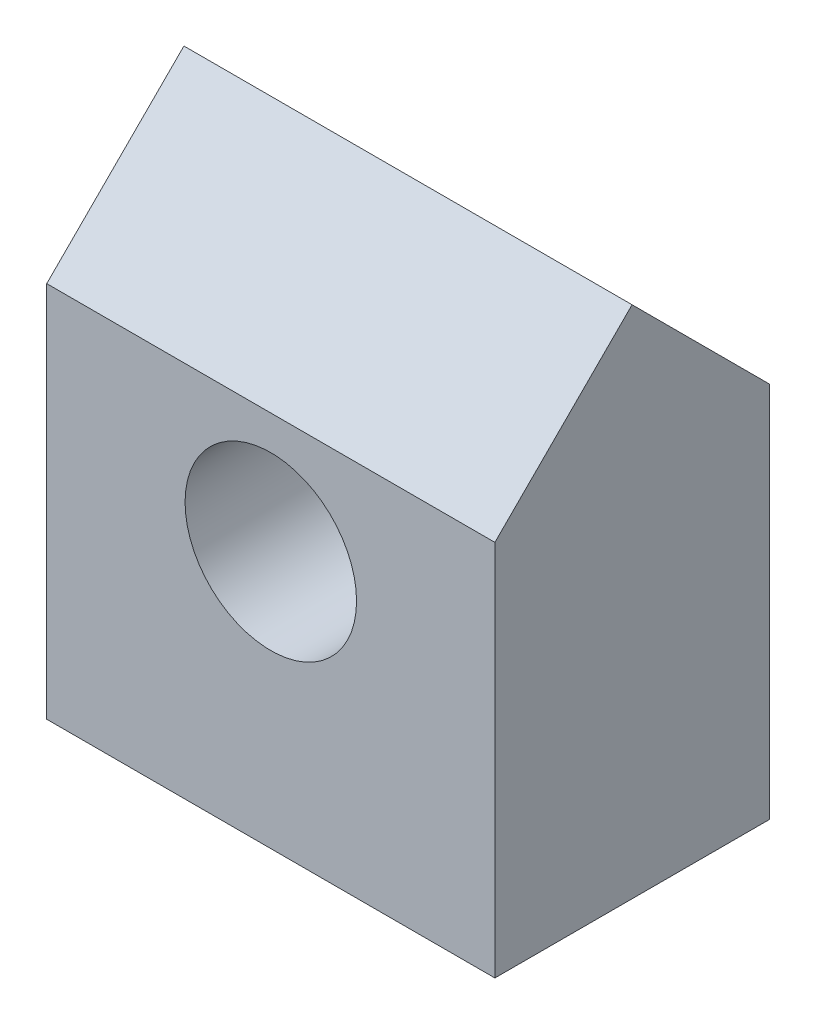
from build123d import *

# Parameters (mm, degrees)
SKETCH_1_W          = 3.92
SKETCH_1_H          = 2.4
EXTRUDE_1_DEPTH     = 4.5
SKETCH_2_R          = 0.75
CUT_EXTRUDE_1_DEPTH = 4.5
CHAMFER_1_SIZE      = 1.2


with BuildPart() as part:
    # 草图1 → 凸台-拉伸1 (new body)
    with BuildSketch(Plane(origin=(0, 0, 0), x_dir=(1, 0, 0), z_dir=(0, 1, 0))):
        with Locations((1.96, -1.2)):
            Rectangle(SKETCH_1_W, SKETCH_1_H)
    extrude(amount=EXTRUDE_1_DEPTH)

    # 草图2 → 切除-拉伸1 (cut)
    with BuildSketch(Plane.XY.offset(2.4)):
        with Locations((1.96, 2.25)):
            Circle(SKETCH_2_R)
    extrude(amount=-CUT_EXTRUDE_1_DEPTH, mode=Mode.SUBTRACT)

    # 倒角1
    chamfer_1_edges = [part.edges().sort_by_distance(p)[0] for p in [
        (1.96, 4.5, 0),
        (1.96, 4.5, 2.4),
    ]]
    chamfer(chamfer_1_edges, length=CHAMFER_1_SIZE - 0.0001)  # a hair under: the kernel refuses the full size


solid = part.part
